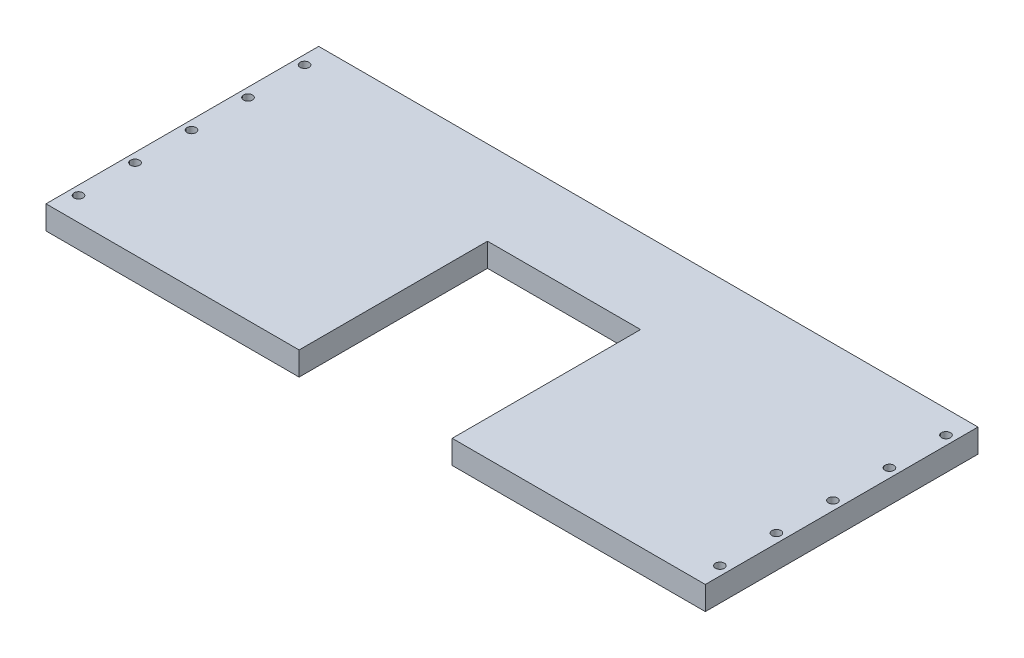
from build123d import *

# Parameters (mm, degrees)
BOSS_EXTRUDE1_DEPTH  = 12.7
SKETCH2_R            = 2.413
CUT_EXTRUDE1_DEPTH   = 206.174779152
LPATTERN2_COUNT      = 2
LPATTERN2_PITCH      = 345.948
LPATTERN2_COUNT_DIR2 = 5
LPATTERN2_PITCH_DIR2 = 30.48


with BuildPart() as part:
    # Sketch1 → Boss-Extrude1 (new body)
    with BuildSketch(Plane(origin=(0, 0, 0), x_dir=(1, 0, 0), z_dir=(0, 1, 0))):
        Polygon((-41.275, -101.6), (-41.275, 0), (41.275, 0), (41.275, -101.6), (177.8, -101.6), (177.8, 45.466), (-177.8, 45.466), (-177.8, -101.6), align=None)
    extrude(amount=BOSS_EXTRUDE1_DEPTH)

    # Sketch2 → Cut-Extrude1 (cut, through all)
    with BuildSketch(Plane(origin=(0, 12.7, 0), x_dir=(1, 0, 0), z_dir=(0, 1, 0))):
        with Locations((172.974, -88.9)):
            Circle(SKETCH2_R)
    cut_extrude1 = extrude(amount=-CUT_EXTRUDE1_DEPTH, mode=Mode.SUBTRACT)

    # LPattern2: Cut-Extrude1 2 × 5
    with Locations(*[(-i * LPATTERN2_PITCH, 0, -j * LPATTERN2_PITCH_DIR2) for i in range(LPATTERN2_COUNT) for j in range(LPATTERN2_COUNT_DIR2) if (i, j) != (0, 0)]):
        add(cut_extrude1, mode=Mode.SUBTRACT)


solid = part.part
